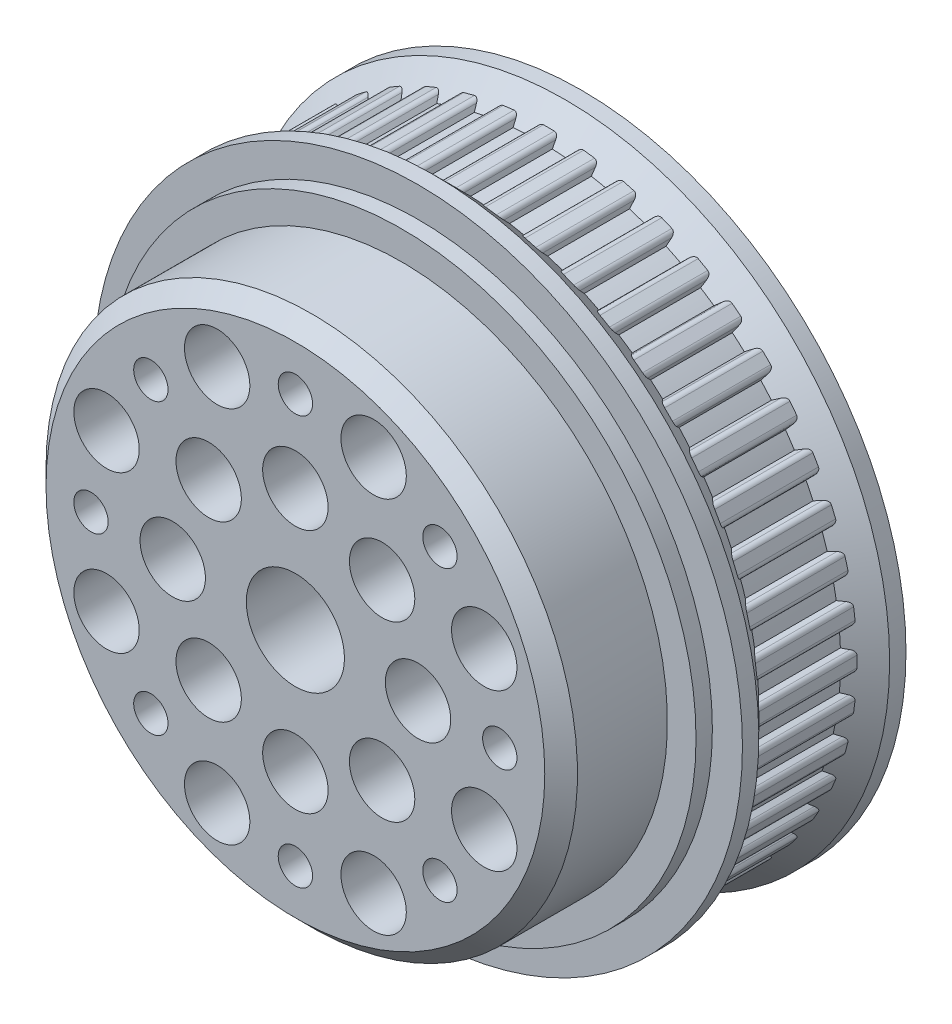
from build123d import *

# Parameters (mm, degrees)
ESQUISSE1_R             = 30
BOSS_EXTRU_1_DEPTH      = 16
BOSS_EXTRU_2_START      = 2
ESQUISSE4_R             = 36
ESQUISSE4_R_2           = 6
BOSS_EXTRU_2_DEPTH      = 2
BOSS_EXTRU_3_START      = 13
ESQUISSE5_R             = 32.5
ESQUISSE5_R_2           = 6
BOSS_EXTRU_3_DEPTH      = 13
ESQUISSE3_R             = 2.1
ENL_V_MAT_EXTRU_1_DEPTH = 67.134271813
ESQUISSE6_R             = 4
ENL_V_MAT_EXTRU_2_DEPTH = 67.134271813
CHANFREIN1_SIZE         = 2


with BuildPart() as part:
    # Esquisse1 → Boss.-Extru.1 (new body)
    with BuildSketch(Plane.XY):
        with BuildLine():
            Line((1.485544014, 36.425831274), (3.281690076, 36.308105641))
            Line((3.281690076, 36.308105641), (3.625856871, 37.090284182))
            ThreePointArc((3.625856871, 37.090284182), (3.880729617, 37.371492923), (4.253359473, 37.443503085))
            Line((4.253359473, 37.443503085), (4.918010712, 37.356000089))
            Line((4.918010712, 37.356000089), (5.58266195, 37.268497094))
            ThreePointArc((5.58266195, 37.268497094), (5.92395715, 37.102496915), (6.097363141, 36.764904209))
            Line((6.097363141, 36.764904209), (6.227360034, 35.920300834))
            Line((6.227360034, 35.920300834), (7.992773538, 35.569138254))
            Line((7.992773538, 35.569138254), (8.436090725, 36.299702368))
            ThreePointArc((8.436090725, 36.299702368), (8.725488106, 36.545237761), (9.104329275, 36.567993909))
            Line((9.104329275, 36.567993909), (9.751872896, 36.394485118))
            Line((9.751872896, 36.394485118), (10.399416518, 36.220976328))
            ThreePointArc((10.399416518, 36.220976328), (10.71612452, 36.011848341), (10.843982307, 35.654509763))
            Line((10.843982307, 35.654509763), (10.862624196, 34.800164088))
            Line((10.862624196, 34.800164088), (12.56709843, 34.221573051))
            Line((12.56709843, 34.221573051), (13.101980728, 34.888022583))
            ThreePointArc((13.101980728, 34.888022583), (13.420951075, 35.093683448), (13.799521478, 35.066796219))
            Line((13.799521478, 35.066796219), (14.418877832, 34.810250417))
            Line((14.418877832, 34.810250417), (15.038234187, 34.553704615))
            ThreePointArc((15.038234187, 34.553704615), (15.324936028, 34.305027057), (15.40505793, 33.93405677))
            Line((15.40505793, 33.93405677), (15.312025848, 33.084586886))
            Line((15.312025848, 33.084586886), (16.926396782, 32.288467244))
            Line((16.926396782, 32.288467244), (17.543692209, 32.879399058))
            ThreePointArc((17.543692209, 32.879399058), (17.886777849, 33.041666481), (18.258600042, 32.965595923))
            Line((18.258600042, 32.965595923), (18.839171771, 32.630402679))
            Line((18.839171771, 32.630402679), (19.419743499, 32.295209436))
            ThreePointArc((19.419743499, 32.295209436), (19.671533631, 32.01123725), (19.702548741, 31.632982658))
            Line((19.702548741, 31.632982658), (19.499434491, 30.80292323))
            Line((19.499434491, 30.80292323), (20.996079793, 29.802896811))
            Line((20.996079793, 29.802896811), (21.685226251, 30.3081999))
            ThreePointArc((21.685226251, 30.3081999), (22.046556895, 30.42429744), (22.405268898, 30.300345141))
            Line((22.405268898, 30.300345141), (22.937122257, 29.892239705))
            Line((22.937122257, 29.892239705), (23.468975616, 29.484134269))
            ThreePointArc((23.468975616, 29.484134269), (23.681545841, 29.169726297), (23.66292348, 28.790659442))
            Line((23.66292348, 28.790659442), (23.353202405, 27.994213017))
            Line((23.353202405, 27.994213017), (24.706514058, 26.80739055))
            Line((24.706514058, 26.80739055), (25.455720061, 27.218419038))
            ThreePointArc((25.455720061, 27.218419038), (25.829113241, 27.286360235), (26.168577391, 27.116647053))
            Line((26.168577391, 27.116647053), (26.642612222, 26.642612222))
            Line((26.642612222, 26.642612222), (27.116647053, 26.168577391))
            ThreePointArc((27.116647053, 26.168577391), (27.286360235, 25.829113241), (27.218419038, 25.455720061))
            Line((27.218419038, 25.455720061), (26.80739055, 24.706514058))
            Line((26.80739055, 24.706514058), (27.994213017, 23.353202405))
            Line((27.994213017, 23.353202405), (28.790659442, 23.66292348))
            ThreePointArc((28.790659442, 23.66292348), (29.169726297, 23.681545841), (29.484134269, 23.468975616))
            Line((29.484134269, 23.468975616), (29.892239705, 22.937122257))
            Line((29.892239705, 22.937122257), (30.300345141, 22.405268898))
            ThreePointArc((30.300345141, 22.405268898), (30.42429744, 22.046556895), (30.3081999, 21.685226251))
            Line((30.3081999, 21.685226251), (29.802896811, 20.996079793))
            Line((29.802896811, 20.996079793), (30.80292323, 19.499434491))
            Line((30.80292323, 19.499434491), (31.632982658, 19.702548741))
            ThreePointArc((31.632982658, 19.702548741), (32.01123725, 19.671533631), (32.295209436, 19.419743499))
            Line((32.295209436, 19.419743499), (32.630402679, 18.839171771))
            Line((32.630402679, 18.839171771), (32.965595923, 18.258600042))
            ThreePointArc((32.965595923, 18.258600042), (33.041666481, 17.886777849), (32.879399058, 17.543692209))
            Line((32.879399058, 17.543692209), (32.288467244, 16.926396782))
            Line((32.288467244, 16.926396782), (33.084586886, 15.312025848))
            Line((33.084586886, 15.312025848), (33.93405677, 15.40505793))
            ThreePointArc((33.93405677, 15.40505793), (34.305027057, 15.324936028), (34.553704615, 15.038234187))
            Line((34.553704615, 15.038234187), (34.810250417, 14.418877832))
            Line((34.810250417, 14.418877832), (35.066796219, 13.799521478))
            ThreePointArc((35.066796219, 13.799521478), (35.093683448, 13.420951075), (34.888022583, 13.101980728))
            Line((34.888022583, 13.101980728), (34.221573051, 12.56709843))
            Line((34.221573051, 12.56709843), (34.800164088, 10.862624196))
            Line((34.800164088, 10.862624196), (35.654509763, 10.843982307))
            ThreePointArc((35.654509763, 10.843982307), (36.011848341, 10.71612452), (36.220976328, 10.399416518))
            Line((36.220976328, 10.399416518), (36.394485118, 9.751872896))
            Line((36.394485118, 9.751872896), (36.567993909, 9.104329275))
            ThreePointArc((36.567993909, 9.104329275), (36.545237761, 8.725488106), (36.299702368, 8.436090725))
            Line((36.299702368, 8.436090725), (35.569138254, 7.992773538))
            Line((35.569138254, 7.992773538), (35.920300834, 6.227360034))
            Line((35.920300834, 6.227360034), (36.764904209, 6.097363141))
            ThreePointArc((36.764904209, 6.097363141), (37.102496915, 5.92395715), (37.268497094, 5.58266195))
            Line((37.268497094, 5.58266195), (37.356000089, 4.918010712))
            Line((37.356000089, 4.918010712), (37.443503085, 4.253359473))
            ThreePointArc((37.443503085, 4.253359473), (37.371492923, 3.880729617), (37.090284182, 3.625856871))
            Line((37.090284182, 3.625856871), (36.308105641, 3.281690076))
            Line((36.308105641, 3.281690076), (36.425831274, 1.485544014))
            Line((36.425831274, 1.485544014), (37.24624095, 1.2464164))
            ThreePointArc((37.24624095, 1.2464164), (37.55831148, 1.030429231), (37.678343541, 0.670386487))
            Line((37.678343541, 0.670386487), (37.678343541, 0))
            Line((37.678343541, 0), (37.678343541, -0.670386487))
            ThreePointArc((37.678343541, -0.670386487), (37.55831148, -1.030429231), (37.24624095, -1.2464164))
            Line((37.24624095, -1.2464164), (36.425831274, -1.485544014))
            Line((36.425831274, -1.485544014), (36.308105641, -3.281690076))
            Line((36.308105641, -3.281690076), (37.090284182, -3.625856871))
            ThreePointArc((37.090284182, -3.625856871), (37.371492923, -3.880729617), (37.443503085, -4.253359473))
            Line((37.443503085, -4.253359473), (37.356000089, -4.918010712))
            Line((37.356000089, -4.918010712), (37.268497094, -5.58266195))
            ThreePointArc((37.268497094, -5.58266195), (37.102496915, -5.92395715), (36.764904209, -6.097363141))
            Line((36.764904209, -6.097363141), (35.920300834, -6.227360034))
            Line((35.920300834, -6.227360034), (35.569138254, -7.992773538))
            Line((35.569138254, -7.992773538), (36.299702368, -8.436090725))
            ThreePointArc((36.299702368, -8.436090725), (36.545237761, -8.725488106), (36.567993909, -9.104329275))
            Line((36.567993909, -9.104329275), (36.394485118, -9.751872896))
            Line((36.394485118, -9.751872896), (36.220976328, -10.399416518))
            ThreePointArc((36.220976328, -10.399416518), (36.011848341, -10.71612452), (35.654509763, -10.843982307))
            Line((35.654509763, -10.843982307), (34.800164088, -10.862624196))
            Line((34.800164088, -10.862624196), (34.221573051, -12.56709843))
            Line((34.221573051, -12.56709843), (34.888022583, -13.101980728))
            ThreePointArc((34.888022583, -13.101980728), (35.093683448, -13.420951075), (35.066796219, -13.799521478))
            Line((35.066796219, -13.799521478), (34.810250417, -14.418877832))
            Line((34.810250417, -14.418877832), (34.553704615, -15.038234187))
            ThreePointArc((34.553704615, -15.038234187), (34.305027057, -15.324936028), (33.93405677, -15.40505793))
            Line((33.93405677, -15.40505793), (33.084586886, -15.312025848))
            Line((33.084586886, -15.312025848), (32.288467244, -16.926396782))
            Line((32.288467244, -16.926396782), (32.879399058, -17.543692209))
            ThreePointArc((32.879399058, -17.543692209), (33.041666481, -17.886777849), (32.965595923, -18.258600042))
            Line((32.965595923, -18.258600042), (32.630402679, -18.839171771))
            Line((32.630402679, -18.839171771), (32.295209436, -19.419743499))
            ThreePointArc((32.295209436, -19.419743499), (32.01123725, -19.671533631), (31.632982658, -19.702548741))
            Line((31.632982658, -19.702548741), (30.80292323, -19.499434491))
            Line((30.80292323, -19.499434491), (29.802896811, -20.996079793))
            Line((29.802896811, -20.996079793), (30.3081999, -21.685226251))
            ThreePointArc((30.3081999, -21.685226251), (30.42429744, -22.046556895), (30.300345141, -22.405268898))
            Line((30.300345141, -22.405268898), (29.892239705, -22.937122257))
            Line((29.892239705, -22.937122257), (29.484134269, -23.468975616))
            ThreePointArc((29.484134269, -23.468975616), (29.169726297, -23.681545841), (28.790659442, -23.66292348))
            Line((28.790659442, -23.66292348), (27.994213017, -23.353202405))
            Line((27.994213017, -23.353202405), (26.80739055, -24.706514058))
            Line((26.80739055, -24.706514058), (27.218419038, -25.455720061))
            ThreePointArc((27.218419038, -25.455720061), (27.286360235, -25.829113241), (27.116647053, -26.168577391))
            Line((27.116647053, -26.168577391), (26.642612222, -26.642612222))
            Line((26.642612222, -26.642612222), (26.168577391, -27.116647053))
            ThreePointArc((26.168577391, -27.116647053), (25.829113241, -27.286360235), (25.455720061, -27.218419038))
            Line((25.455720061, -27.218419038), (24.706514058, -26.80739055))
            Line((24.706514058, -26.80739055), (23.353202405, -27.994213017))
            Line((23.353202405, -27.994213017), (23.66292348, -28.790659442))
            ThreePointArc((23.66292348, -28.790659442), (23.681545841, -29.169726297), (23.468975616, -29.484134269))
            Line((23.468975616, -29.484134269), (22.937122257, -29.892239705))
            Line((22.937122257, -29.892239705), (22.405268898, -30.300345141))
            ThreePointArc((22.405268898, -30.300345141), (22.046556895, -30.42429744), (21.685226251, -30.3081999))
            Line((21.685226251, -30.3081999), (20.996079793, -29.802896811))
            Line((20.996079793, -29.802896811), (19.499434491, -30.80292323))
            Line((19.499434491, -30.80292323), (19.702548741, -31.632982658))
            ThreePointArc((19.702548741, -31.632982658), (19.671533631, -32.01123725), (19.419743499, -32.295209436))
            Line((19.419743499, -32.295209436), (18.839171771, -32.630402679))
            Line((18.839171771, -32.630402679), (18.258600042, -32.965595923))
            ThreePointArc((18.258600042, -32.965595923), (17.886777849, -33.041666481), (17.543692209, -32.879399058))
            Line((17.543692209, -32.879399058), (16.926396782, -32.288467244))
            Line((16.926396782, -32.288467244), (15.312025848, -33.084586886))
            Line((15.312025848, -33.084586886), (15.40505793, -33.93405677))
            ThreePointArc((15.40505793, -33.93405677), (15.324936028, -34.305027057), (15.038234187, -34.553704615))
            Line((15.038234187, -34.553704615), (14.418877832, -34.810250417))
            Line((14.418877832, -34.810250417), (13.799521478, -35.066796219))
            ThreePointArc((13.799521478, -35.066796219), (13.420951075, -35.093683448), (13.101980728, -34.888022583))
            Line((13.101980728, -34.888022583), (12.56709843, -34.221573051))
            Line((12.56709843, -34.221573051), (10.862624196, -34.800164088))
            Line((10.862624196, -34.800164088), (10.843982307, -35.654509763))
            ThreePointArc((10.843982307, -35.654509763), (10.71612452, -36.011848341), (10.399416518, -36.220976328))
            Line((10.399416518, -36.220976328), (9.751872896, -36.394485118))
            Line((9.751872896, -36.394485118), (9.104329275, -36.567993909))
            ThreePointArc((9.104329275, -36.567993909), (8.725488106, -36.545237761), (8.436090725, -36.299702368))
            Line((8.436090725, -36.299702368), (7.992773538, -35.569138254))
            Line((7.992773538, -35.569138254), (6.227360034, -35.920300834))
            Line((6.227360034, -35.920300834), (6.097363141, -36.764904209))
            ThreePointArc((6.097363141, -36.764904209), (5.92395715, -37.102496915), (5.58266195, -37.268497094))
            Line((5.58266195, -37.268497094), (4.918010712, -37.356000089))
            Line((4.918010712, -37.356000089), (4.253359473, -37.443503085))
            ThreePointArc((4.253359473, -37.443503085), (3.880729617, -37.371492923), (3.625856871, -37.090284182))
            Line((3.625856871, -37.090284182), (3.281690076, -36.308105641))
            Line((3.281690076, -36.308105641), (1.485544014, -36.425831274))
            Line((1.485544014, -36.425831274), (1.2464164, -37.24624095))
            ThreePointArc((1.2464164, -37.24624095), (1.030429231, -37.55831148), (0.670386487, -37.678343541))
            Line((0.670386487, -37.678343541), (0, -37.678343541))
            Line((0, -37.678343541), (-0.670386487, -37.678343541))
            ThreePointArc((-0.670386487, -37.678343541), (-1.030429231, -37.55831148), (-1.2464164, -37.24624095))
            Line((-1.2464164, -37.24624095), (-1.485544014, -36.425831274))
            Line((-1.485544014, -36.425831274), (-3.281690076, -36.308105641))
            Line((-3.281690076, -36.308105641), (-3.625856871, -37.090284182))
            ThreePointArc((-3.625856871, -37.090284182), (-3.880729617, -37.371492923), (-4.253359473, -37.443503085))
            Line((-4.253359473, -37.443503085), (-4.918010712, -37.356000089))
            Line((-4.918010712, -37.356000089), (-5.58266195, -37.268497094))
            ThreePointArc((-5.58266195, -37.268497094), (-5.92395715, -37.102496915), (-6.097363141, -36.764904209))
            Line((-6.097363141, -36.764904209), (-6.227360034, -35.920300834))
            Line((-6.227360034, -35.920300834), (-7.992773538, -35.569138254))
            Line((-7.992773538, -35.569138254), (-8.436090725, -36.299702368))
            ThreePointArc((-8.436090725, -36.299702368), (-8.725488106, -36.545237761), (-9.104329275, -36.567993909))
            Line((-9.104329275, -36.567993909), (-9.751872896, -36.394485118))
            Line((-9.751872896, -36.394485118), (-10.399416518, -36.220976328))
            ThreePointArc((-10.399416518, -36.220976328), (-10.71612452, -36.011848341), (-10.843982307, -35.654509763))
            Line((-10.843982307, -35.654509763), (-10.862624196, -34.800164088))
            Line((-10.862624196, -34.800164088), (-12.56709843, -34.221573051))
            Line((-12.56709843, -34.221573051), (-13.101980728, -34.888022583))
            ThreePointArc((-13.101980728, -34.888022583), (-13.420951075, -35.093683448), (-13.799521478, -35.066796219))
            Line((-13.799521478, -35.066796219), (-14.418877832, -34.810250417))
            Line((-14.418877832, -34.810250417), (-15.038234187, -34.553704615))
            ThreePointArc((-15.038234187, -34.553704615), (-15.324936028, -34.305027057), (-15.40505793, -33.93405677))
            Line((-15.40505793, -33.93405677), (-15.312025848, -33.084586886))
            Line((-15.312025848, -33.084586886), (-16.926396782, -32.288467244))
            Line((-16.926396782, -32.288467244), (-17.543692209, -32.879399058))
            ThreePointArc((-17.543692209, -32.879399058), (-17.886777849, -33.041666481), (-18.258600042, -32.965595923))
            Line((-18.258600042, -32.965595923), (-18.839171771, -32.630402679))
            Line((-18.839171771, -32.630402679), (-19.419743499, -32.295209436))
            ThreePointArc((-19.419743499, -32.295209436), (-19.671533631, -32.01123725), (-19.702548741, -31.632982658))
            Line((-19.702548741, -31.632982658), (-19.499434491, -30.80292323))
            Line((-19.499434491, -30.80292323), (-20.996079793, -29.802896811))
            Line((-20.996079793, -29.802896811), (-21.685226251, -30.3081999))
            ThreePointArc((-21.685226251, -30.3081999), (-22.046556895, -30.42429744), (-22.405268898, -30.300345141))
            Line((-22.405268898, -30.300345141), (-22.937122257, -29.892239705))
            Line((-22.937122257, -29.892239705), (-23.468975616, -29.484134269))
            ThreePointArc((-23.468975616, -29.484134269), (-23.681545841, -29.169726297), (-23.66292348, -28.790659442))
            Line((-23.66292348, -28.790659442), (-23.353202405, -27.994213017))
            Line((-23.353202405, -27.994213017), (-24.706514058, -26.80739055))
            Line((-24.706514058, -26.80739055), (-25.455720061, -27.218419038))
            ThreePointArc((-25.455720061, -27.218419038), (-25.829113241, -27.286360235), (-26.168577391, -27.116647053))
            Line((-26.168577391, -27.116647053), (-26.642612222, -26.642612222))
            Line((-26.642612222, -26.642612222), (-27.116647053, -26.168577391))
            ThreePointArc((-27.116647053, -26.168577391), (-27.286360235, -25.829113241), (-27.218419038, -25.455720061))
            Line((-27.218419038, -25.455720061), (-26.80739055, -24.706514058))
            Line((-26.80739055, -24.706514058), (-27.994213017, -23.353202405))
            Line((-27.994213017, -23.353202405), (-28.790659442, -23.66292348))
            ThreePointArc((-28.790659442, -23.66292348), (-29.169726297, -23.681545841), (-29.484134269, -23.468975616))
            Line((-29.484134269, -23.468975616), (-29.892239705, -22.937122257))
            Line((-29.892239705, -22.937122257), (-30.300345141, -22.405268898))
            ThreePointArc((-30.300345141, -22.405268898), (-30.42429744, -22.046556895), (-30.3081999, -21.685226251))
            Line((-30.3081999, -21.685226251), (-29.802896811, -20.996079793))
            Line((-29.802896811, -20.996079793), (-30.80292323, -19.499434491))
            Line((-30.80292323, -19.499434491), (-31.632982658, -19.702548741))
            ThreePointArc((-31.632982658, -19.702548741), (-32.01123725, -19.671533631), (-32.295209436, -19.419743499))
            Line((-32.295209436, -19.419743499), (-32.630402679, -18.839171771))
            Line((-32.630402679, -18.839171771), (-32.965595923, -18.258600042))
            ThreePointArc((-32.965595923, -18.258600042), (-33.041666481, -17.886777849), (-32.879399058, -17.543692209))
            Line((-32.879399058, -17.543692209), (-32.288467244, -16.926396782))
            Line((-32.288467244, -16.926396782), (-33.084586886, -15.312025848))
            Line((-33.084586886, -15.312025848), (-33.93405677, -15.40505793))
            ThreePointArc((-33.93405677, -15.40505793), (-34.305027057, -15.324936028), (-34.553704615, -15.038234187))
            Line((-34.553704615, -15.038234187), (-34.810250417, -14.418877832))
            Line((-34.810250417, -14.418877832), (-35.066796219, -13.799521478))
            ThreePointArc((-35.066796219, -13.799521478), (-35.093683448, -13.420951075), (-34.888022583, -13.101980728))
            Line((-34.888022583, -13.101980728), (-34.221573051, -12.56709843))
            Line((-34.221573051, -12.56709843), (-34.800164088, -10.862624196))
            Line((-34.800164088, -10.862624196), (-35.654509763, -10.843982307))
            ThreePointArc((-35.654509763, -10.843982307), (-36.011848341, -10.71612452), (-36.220976328, -10.399416518))
            Line((-36.220976328, -10.399416518), (-36.394485118, -9.751872896))
            Line((-36.394485118, -9.751872896), (-36.567993909, -9.104329275))
            ThreePointArc((-36.567993909, -9.104329275), (-36.545237761, -8.725488106), (-36.299702368, -8.436090725))
            Line((-36.299702368, -8.436090725), (-35.569138254, -7.992773538))
            Line((-35.569138254, -7.992773538), (-35.920300834, -6.227360034))
            Line((-35.920300834, -6.227360034), (-36.764904209, -6.097363141))
            ThreePointArc((-36.764904209, -6.097363141), (-37.102496915, -5.92395715), (-37.268497094, -5.58266195))
            Line((-37.268497094, -5.58266195), (-37.356000089, -4.918010712))
            Line((-37.356000089, -4.918010712), (-37.443503085, -4.253359473))
            ThreePointArc((-37.443503085, -4.253359473), (-37.371492923, -3.880729617), (-37.090284182, -3.625856871))
            Line((-37.090284182, -3.625856871), (-36.308105641, -3.281690076))
            Line((-36.308105641, -3.281690076), (-36.425831274, -1.485544014))
            Line((-36.425831274, -1.485544014), (-37.24624095, -1.2464164))
            ThreePointArc((-37.24624095, -1.2464164), (-37.55831148, -1.030429231), (-37.678343541, -0.670386487))
            Line((-37.678343541, -0.670386487), (-37.678343541, 0))
            Line((-37.678343541, 0), (-37.678343541, 0.670386487))
            ThreePointArc((-37.678343541, 0.670386487), (-37.55831148, 1.030429231), (-37.24624095, 1.2464164))
            Line((-37.24624095, 1.2464164), (-36.425831274, 1.485544014))
            Line((-36.425831274, 1.485544014), (-36.308105641, 3.281690076))
            Line((-36.308105641, 3.281690076), (-37.090284182, 3.625856871))
            ThreePointArc((-37.090284182, 3.625856871), (-37.371492923, 3.880729617), (-37.443503085, 4.253359473))
            Line((-37.443503085, 4.253359473), (-37.356000089, 4.918010712))
            Line((-37.356000089, 4.918010712), (-37.268497094, 5.58266195))
            ThreePointArc((-37.268497094, 5.58266195), (-37.102496915, 5.92395715), (-36.764904209, 6.097363141))
            Line((-36.764904209, 6.097363141), (-35.920300834, 6.227360034))
            Line((-35.920300834, 6.227360034), (-35.569138254, 7.992773538))
            Line((-35.569138254, 7.992773538), (-36.299702368, 8.436090725))
            ThreePointArc((-36.299702368, 8.436090725), (-36.545237761, 8.725488106), (-36.567993909, 9.104329275))
            Line((-36.567993909, 9.104329275), (-36.394485118, 9.751872896))
            Line((-36.394485118, 9.751872896), (-36.220976328, 10.399416518))
            ThreePointArc((-36.220976328, 10.399416518), (-36.011848341, 10.71612452), (-35.654509763, 10.843982307))
            Line((-35.654509763, 10.843982307), (-34.800164088, 10.862624196))
            Line((-34.800164088, 10.862624196), (-34.221573051, 12.56709843))
            Line((-34.221573051, 12.56709843), (-34.888022583, 13.101980728))
            ThreePointArc((-34.888022583, 13.101980728), (-35.093683448, 13.420951075), (-35.066796219, 13.799521478))
            Line((-35.066796219, 13.799521478), (-34.810250417, 14.418877832))
            Line((-34.810250417, 14.418877832), (-34.553704615, 15.038234187))
            ThreePointArc((-34.553704615, 15.038234187), (-34.305027057, 15.324936028), (-33.93405677, 15.40505793))
            Line((-33.93405677, 15.40505793), (-33.084586886, 15.312025848))
            Line((-33.084586886, 15.312025848), (-32.288467244, 16.926396782))
            Line((-32.288467244, 16.926396782), (-32.879399058, 17.543692209))
            ThreePointArc((-32.879399058, 17.543692209), (-33.041666481, 17.886777849), (-32.965595923, 18.258600042))
            Line((-32.965595923, 18.258600042), (-32.630402679, 18.839171771))
            Line((-32.630402679, 18.839171771), (-32.295209436, 19.419743499))
            ThreePointArc((-32.295209436, 19.419743499), (-32.01123725, 19.671533631), (-31.632982658, 19.702548741))
            Line((-31.632982658, 19.702548741), (-30.80292323, 19.499434491))
            Line((-30.80292323, 19.499434491), (-29.802896811, 20.996079793))
            Line((-29.802896811, 20.996079793), (-30.3081999, 21.685226251))
            ThreePointArc((-30.3081999, 21.685226251), (-30.42429744, 22.046556895), (-30.300345141, 22.405268898))
            Line((-30.300345141, 22.405268898), (-29.892239705, 22.937122257))
            Line((-29.892239705, 22.937122257), (-29.484134269, 23.468975616))
            ThreePointArc((-29.484134269, 23.468975616), (-29.169726297, 23.681545841), (-28.790659442, 23.66292348))
            Line((-28.790659442, 23.66292348), (-27.994213017, 23.353202405))
            Line((-27.994213017, 23.353202405), (-26.80739055, 24.706514058))
            Line((-26.80739055, 24.706514058), (-27.218419038, 25.455720061))
            ThreePointArc((-27.218419038, 25.455720061), (-27.286360235, 25.829113241), (-27.116647053, 26.168577391))
            Line((-27.116647053, 26.168577391), (-26.642612222, 26.642612222))
            Line((-26.642612222, 26.642612222), (-26.168577391, 27.116647053))
            ThreePointArc((-26.168577391, 27.116647053), (-25.829113241, 27.286360235), (-25.455720061, 27.218419038))
            Line((-25.455720061, 27.218419038), (-24.706514058, 26.80739055))
            Line((-24.706514058, 26.80739055), (-23.353202405, 27.994213017))
            Line((-23.353202405, 27.994213017), (-23.66292348, 28.790659442))
            ThreePointArc((-23.66292348, 28.790659442), (-23.681545841, 29.169726297), (-23.468975616, 29.484134269))
            Line((-23.468975616, 29.484134269), (-22.937122257, 29.892239705))
            Line((-22.937122257, 29.892239705), (-22.405268898, 30.300345141))
            ThreePointArc((-22.405268898, 30.300345141), (-22.046556895, 30.42429744), (-21.685226251, 30.3081999))
            Line((-21.685226251, 30.3081999), (-20.996079793, 29.802896811))
            Line((-20.996079793, 29.802896811), (-19.499434491, 30.80292323))
            Line((-19.499434491, 30.80292323), (-19.702548741, 31.632982658))
            ThreePointArc((-19.702548741, 31.632982658), (-19.671533631, 32.01123725), (-19.419743499, 32.295209436))
            Line((-19.419743499, 32.295209436), (-18.839171771, 32.630402679))
            Line((-18.839171771, 32.630402679), (-18.258600042, 32.965595923))
            ThreePointArc((-18.258600042, 32.965595923), (-17.886777849, 33.041666481), (-17.543692209, 32.879399058))
            Line((-17.543692209, 32.879399058), (-16.926396782, 32.288467244))
            Line((-16.926396782, 32.288467244), (-15.312025848, 33.084586886))
            Line((-15.312025848, 33.084586886), (-15.40505793, 33.93405677))
            ThreePointArc((-15.40505793, 33.93405677), (-15.324936028, 34.305027057), (-15.038234187, 34.553704615))
            Line((-15.038234187, 34.553704615), (-14.418877832, 34.810250417))
            Line((-14.418877832, 34.810250417), (-13.799521478, 35.066796219))
            ThreePointArc((-13.799521478, 35.066796219), (-13.420951075, 35.093683448), (-13.101980728, 34.888022583))
            Line((-13.101980728, 34.888022583), (-12.56709843, 34.221573051))
            Line((-12.56709843, 34.221573051), (-10.862624196, 34.800164088))
            Line((-10.862624196, 34.800164088), (-10.843982307, 35.654509763))
            ThreePointArc((-10.843982307, 35.654509763), (-10.71612452, 36.011848341), (-10.399416518, 36.220976328))
            Line((-10.399416518, 36.220976328), (-9.751872896, 36.394485118))
            Line((-9.751872896, 36.394485118), (-9.104329275, 36.567993909))
            ThreePointArc((-9.104329275, 36.567993909), (-8.725488106, 36.545237761), (-8.436090725, 36.299702368))
            Line((-8.436090725, 36.299702368), (-7.992773538, 35.569138254))
            Line((-7.992773538, 35.569138254), (-6.227360034, 35.920300834))
            Line((-6.227360034, 35.920300834), (-6.097363141, 36.764904209))
            ThreePointArc((-6.097363141, 36.764904209), (-5.92395715, 37.102496915), (-5.58266195, 37.268497094))
            Line((-5.58266195, 37.268497094), (-4.918010712, 37.356000089))
            Line((-4.918010712, 37.356000089), (-4.253359473, 37.443503085))
            ThreePointArc((-4.253359473, 37.443503085), (-3.880729617, 37.371492923), (-3.625856871, 37.090284182))
            Line((-3.625856871, 37.090284182), (-3.281690076, 36.308105641))
            Line((-3.281690076, 36.308105641), (-1.485544014, 36.425831274))
            Line((-1.485544014, 36.425831274), (-1.2464164, 37.24624095))
            ThreePointArc((-1.2464164, 37.24624095), (-1.030429231, 37.55831148), (-0.670386487, 37.678343541))
            Line((-0.670386487, 37.678343541), (0, 37.678343541))
            Line((0, 37.678343541), (0.670386487, 37.678343541))
            ThreePointArc((0.670386487, 37.678343541), (1.030429231, 37.55831148), (1.2464164, 37.24624095))
            Line((1.2464164, 37.24624095), (1.485544014, 36.425831274))
        make_face()
        Circle(ESQUISSE1_R, mode=Mode.SUBTRACT)
    extrude(amount=BOSS_EXTRU_1_DEPTH)

    # Esquisse2 → Révolution1 (revolve)
    with BuildSketch(Plane(origin=(0, 0, 0), x_dir=(1, 0, 0), z_dir=(0, 1, 0))):
        Polygon((-6, 2), (-6, -18), (-39.678343541, -18), (-39.678343541, -16), (-36.678343541, -13), (-36.678343541, -3), (-39.678343541, 0), (-39.678343541, 2), align=None)
    revolve(axis=Axis((0, 0, 0), (0, 0, 1)))

    # Esquisse4 → Boss.-Extru.2 (add)
    with BuildSketch(Plane.XY.offset(18).offset(BOSS_EXTRU_2_START)):
        Circle(ESQUISSE4_R)
        Circle(ESQUISSE4_R_2, mode=Mode.SUBTRACT)
    extrude(amount=-BOSS_EXTRU_2_DEPTH)

    # Esquisse5 → Boss.-Extru.3 (add)
    with BuildSketch(Plane.XY.offset(20).offset(BOSS_EXTRU_3_START)):
        Circle(ESQUISSE5_R)
        Circle(ESQUISSE5_R_2, mode=Mode.SUBTRACT)
    extrude(amount=-BOSS_EXTRU_3_DEPTH)

    # Esquisse3 → Enlèv. mat.-Extru.1 (cut, through all)
    with BuildSketch(Plane(origin=(0, 0, -2), x_dir=(-1, 0, 0), z_dir=(0, 0, -1))):
        with Locations((0, 25)):
            Circle(ESQUISSE3_R)
        with Locations((17.67766953, 17.67766953)):
            Circle(ESQUISSE3_R)
        with Locations((25, 0)):
            Circle(ESQUISSE3_R)
        with Locations((17.67766953, -17.67766953)):
            Circle(ESQUISSE3_R)
        with Locations((0, -25)):
            Circle(ESQUISSE3_R)
        with Locations((-17.67766953, -17.67766953)):
            Circle(ESQUISSE3_R)
        with Locations((-25, 0)):
            Circle(ESQUISSE3_R)
        with Locations((-17.67766953, 17.67766953)):
            Circle(ESQUISSE3_R)
    extrude(amount=-ENL_V_MAT_EXTRU_1_DEPTH, mode=Mode.SUBTRACT)

    # Esquisse6 → Enlèv. mat.-Extru.2 (cut, through all)
    with BuildSketch(Plane.XY.offset(33)):
        with Locations((0, 15)):
            Circle(ESQUISSE6_R)
        with Locations((10.606601718, 10.606601718)):
            Circle(ESQUISSE6_R)
        with Locations((15, 0)):
            Circle(ESQUISSE6_R)
        with Locations((10.606601718, -10.606601718)):
            Circle(ESQUISSE6_R)
        with Locations((0, -15)):
            Circle(ESQUISSE6_R)
        with Locations((-10.606601718, -10.606601718)):
            Circle(ESQUISSE6_R)
        with Locations((-15, 0)):
            Circle(ESQUISSE6_R)
        with Locations((-10.606601718, 10.606601718)):
            Circle(ESQUISSE6_R)
        with Locations((-23.096988313, 9.567085809)):
            Circle(ESQUISSE6_R)
        with Locations((-9.567085809, 23.096988313)):
            Circle(ESQUISSE6_R)
        with Locations((9.567085809, 23.096988313)):
            Circle(ESQUISSE6_R)
        with Locations((23.096988313, 9.567085809)):
            Circle(ESQUISSE6_R)
        with Locations((23.096988313, -9.567085809)):
            Circle(ESQUISSE6_R)
        with Locations((9.567085809, -23.096988313)):
            Circle(ESQUISSE6_R)
        with Locations((-9.567085809, -23.096988313)):
            Circle(ESQUISSE6_R)
        with Locations((-23.096988313, -9.567085809)):
            Circle(ESQUISSE6_R)
    extrude(amount=-ENL_V_MAT_EXTRU_2_DEPTH, mode=Mode.SUBTRACT)

    # Chanfrein1
    chanfrein1_edges = [part.edges().sort_by_distance(p)[0] for p in [
        (-32.5, 0, 33),
    ]]
    chamfer(chanfrein1_edges, length=CHANFREIN1_SIZE)


solid = part.part
